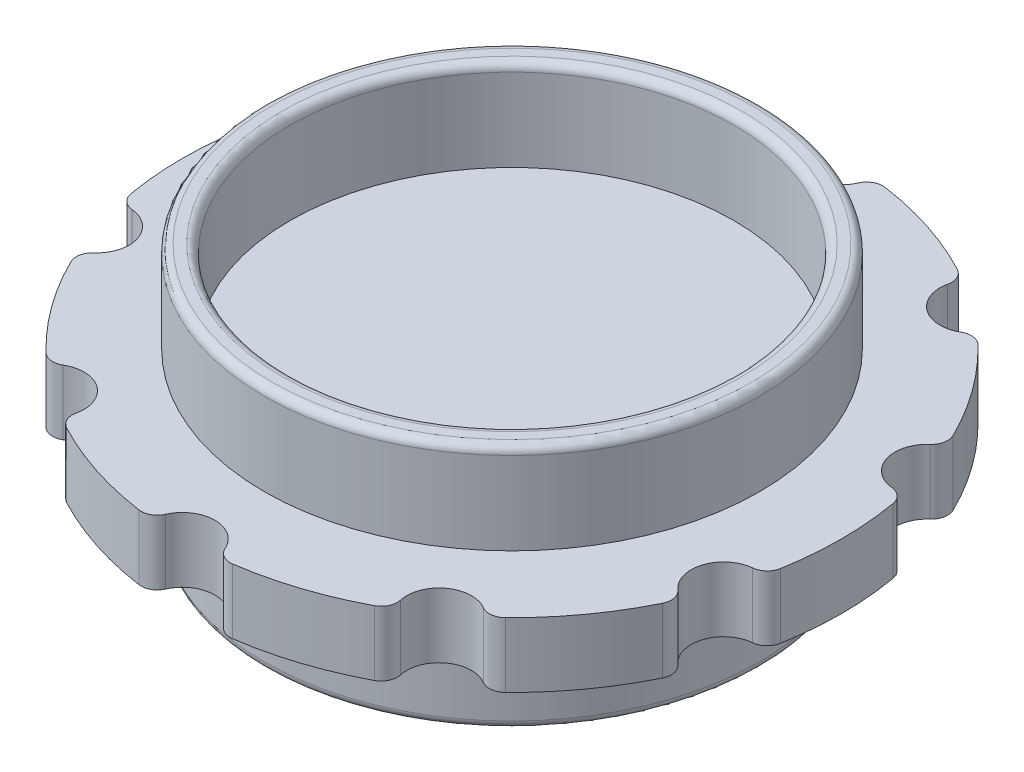
from build123d import *

# Parameters (mm, degrees)
SKETCH_1_R                       = 15.3
SKETCH_1_R_2                     = 13.7
EXTRUDE_1_DEPTH                  = 7.6
SKETCH_1_3_R                     = 20.35
EXTRUDE_2_DEPTH                  = 2
SKETCH_1_4_R                     = 2
CUT_EXTRUDE_1_DEPTH              = 30.765836121
FILLET_1_R                       = 1
PATTERN_CIRCULAR_1_COUNT         = 10
FILLET_1_OF_PATTERN_CIRCULAR_1_R = 1
FILLET_2_R                       = 0.5


with BuildPart() as part:
    # 草图1 → 凸台-拉伸1 (new, symmetric)
    with BuildSketch(Plane(origin=(0, 0, 0), x_dir=(1, 0, 0), z_dir=(0, 1, 0))):
        Circle(SKETCH_1_R)
        Circle(SKETCH_1_R_2, mode=Mode.SUBTRACT)
    extrude(amount=EXTRUDE_1_DEPTH, both=True)

    # 草图1<3> → 凸台-拉伸2 (add, symmetric)
    with BuildSketch(Plane(origin=(0, 0, 0), x_dir=(1, 0, 0), z_dir=(0, 1, 0))):
        Circle(SKETCH_1_3_R)
    extrude(amount=EXTRUDE_2_DEPTH, both=True)

    # 草图1<4> → 切除-拉伸1 (cut, symmetric)
    with BuildSketch(Plane(origin=(0, 0, 0), x_dir=(1, 0, 0), z_dir=(0, 1, 0))):
        with Locations((0, 20.35)):
            Circle(SKETCH_1_4_R)
    cut_extrude_1 = extrude(amount=CUT_EXTRUDE_1_DEPTH, both=True, mode=Mode.SUBTRACT)

    # 圆角1
    fillet_1_edges = [part.edges().sort_by_distance(p)[0] for p in [
        (1.997583796, 0, -20.251719902),
        (-1.997583796, 0, -20.251719902),
    ]]
    fillet(fillet_1_edges, radius=FILLET_1_R)

    # 阵列(圆周)1: 切除-拉伸1 ×10 about axis
    pattern_circular_1_axis = Axis((0, 2, 0), (0, -1, 0))
    for i in range(1, PATTERN_CIRCULAR_1_COUNT):
        add(cut_extrude_1.rotate(pattern_circular_1_axis, i * 360 / PATTERN_CIRCULAR_1_COUNT), mode=Mode.SUBTRACT)

    # 圆角1 of 阵列(圆周)1
    fillet_1_of_pattern_circular_1_edges = [part.edges().sort_by_distance(p)[0] for p in [
        (13.51974153, 0, -15.20983527),
        (10.287583053, 0, -17.558135861),
        (19.877817519, 0, -4.358310529),
        (18.643242838, 0, -8.157940701),
        (18.643242838, 0, 8.157940701),
        (19.877817519, 0, 4.358310529),
        (10.287583053, 0, 17.558135861),
        (13.51974153, 0, 15.20983527),
        (-1.997583796, 0, 20.251719902),
        (1.997583796, 0, 20.251719902),
        (-13.51974153, 0, 15.20983527),
        (-10.287583053, 0, 17.558135861),
        (-19.877817519, 0, 4.358310529),
        (-18.643242838, 0, 8.157940701),
        (-18.643242838, 0, -8.157940701),
        (-19.877817519, 0, -4.358310529),
        (-10.287583053, 0, -17.558135861),
        (-13.51974153, 0, -15.20983527),
    ]]
    fillet(fillet_1_of_pattern_circular_1_edges, radius=FILLET_1_OF_PATTERN_CIRCULAR_1_R)

    # 圆角2
    fillet_2_edges = [part.edges().sort_by_distance(p)[0] for p in [
        (-13.7, -7.6, 0),
        (-15.3, -7.6, 0),
        (-13.7, 7.6, 0),
        (-15.3, 7.6, 0),
    ]]
    fillet(fillet_2_edges, radius=FILLET_2_R)


solid = part.part
